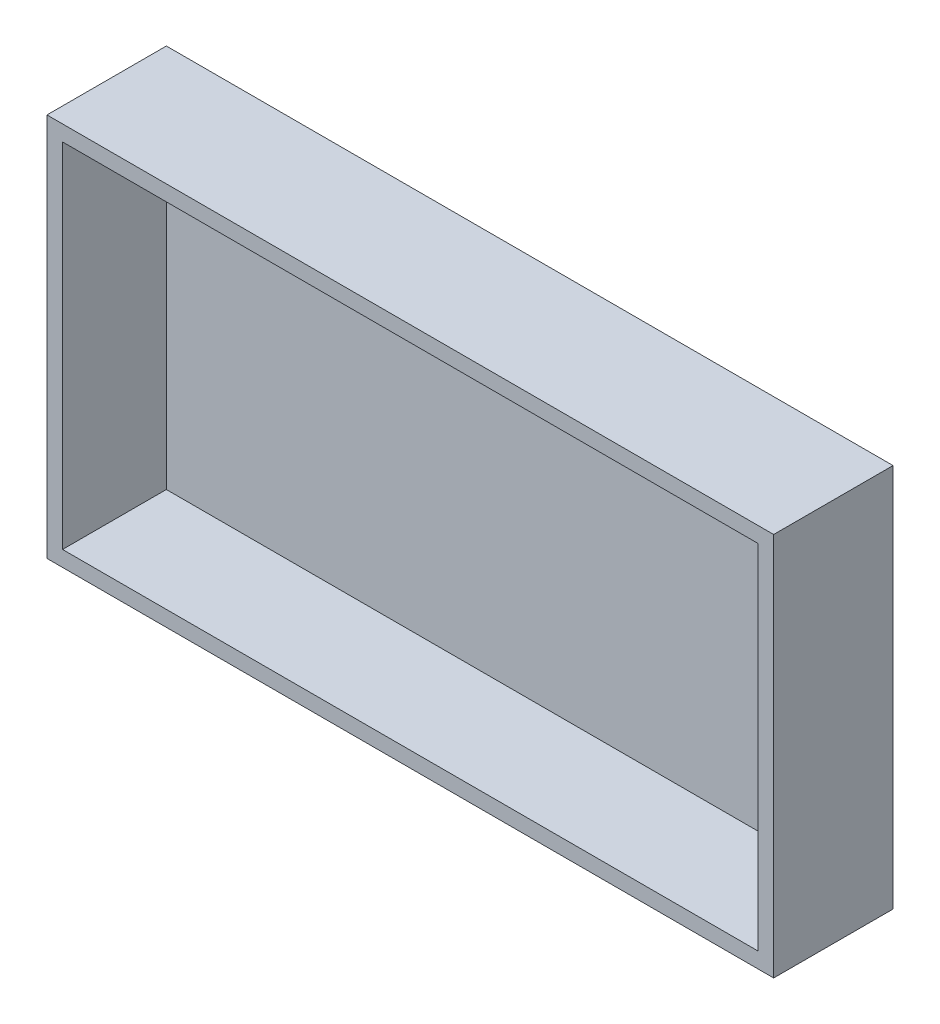
from build123d import *

# Parameters (mm, degrees)
SKETCH_1_W      = 70
SKETCH_1_H      = 37
EXTRUDE_1_DEPTH = 11.5
SHELL_1_T       = -1.5


with BuildPart() as part:
    # 草图1 → 凸台-拉伸1 (new body)
    with BuildSketch(Plane.XY):
        Rectangle(SKETCH_1_W, SKETCH_1_H)
    extrude(amount=EXTRUDE_1_DEPTH)

    # 抽壳1
    shell_1_openings = [part.faces().sort_by_distance(p)[0] for p in [
        (0, 0, 11.5),
    ]]
    offset(amount=SHELL_1_T, openings=shell_1_openings, kind=Kind.INTERSECTION)


solid = part.part
